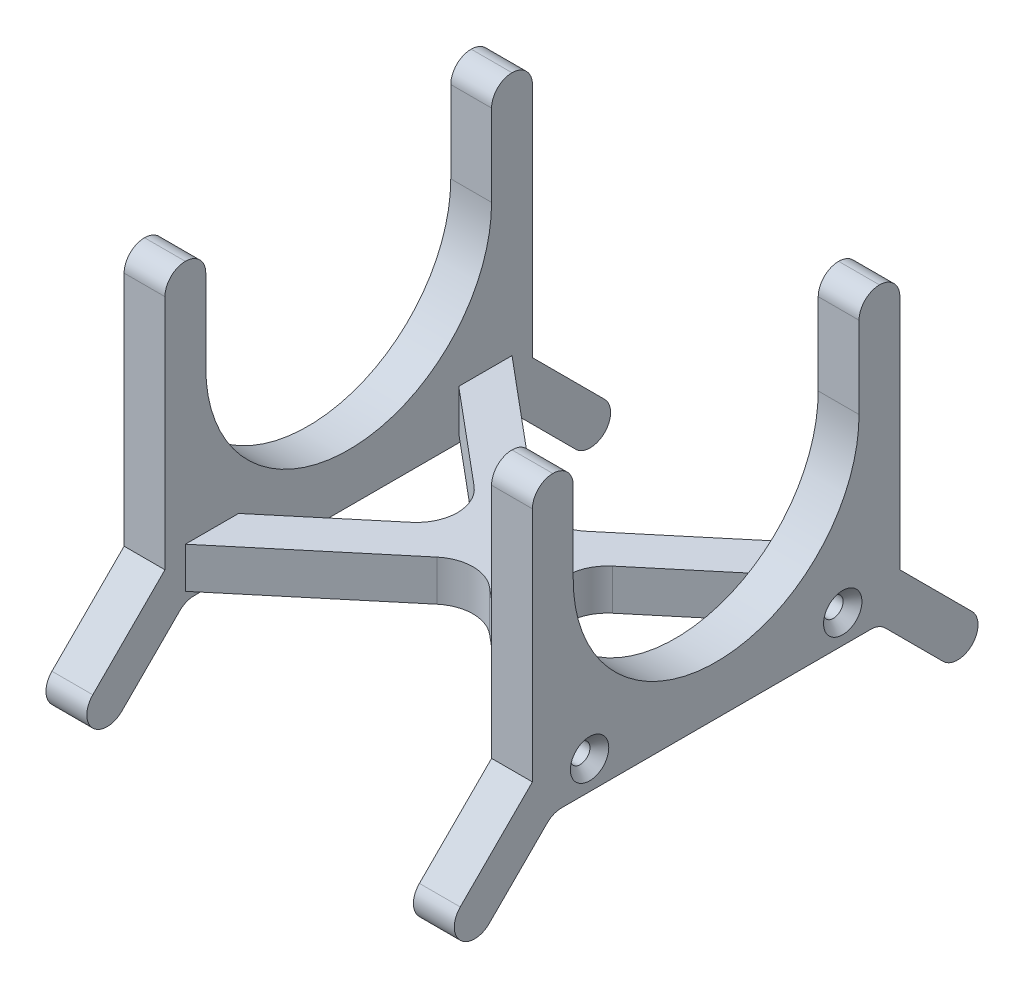
from build123d import *

# Parameters (mm, degrees)
BOSS_EXTRUDE1_DEPTH                            = 10
FILLET1_R                                      = 5
LPATTERN1_COUNT                                = 2
LPATTERN1_PITCH                                = 80
BOSS_EXTRUDE2_DEPTH                            = 10
FILLET2_R                                      = 10
F_6_0MM_DOWEL_HOLE1_OUTLINE_R                  = 3.1
F_6_0MM_DOWEL_HOLE1_DEPTH                      = 6
CSK_FOR_M4_FLAT_HEAD_MACHINE_SCREW3_AT_2_COUNT = 2
CSK_FOR_M4_FLAT_HEAD_MACHINE_SCREW3_AT_2_PITCH = 62
CSK_FOR_M4_FLAT_HEAD_MACHINE_SCREW4_AT_2_COUNT = 2
CSK_FOR_M4_FLAT_HEAD_MACHINE_SCREW4_AT_2_PITCH = 62


# Read off the part's stored shape, not the designer's step: Ø6.0mm Dowel Hole1
with BuildPart() as part:
    # Sketch1 → Boss-Extrude1 (new body)
    with BuildSketch(Plane(origin=(0, 0, 0), x_dir=(0, 0, -1), z_dir=(1, 0, 0))):
        with BuildLine():
            Line((-45, 70), (-45, 7.071067812))
            Line((-45, 7.071067812), (-66.213203436, -14.142135624))
            Line((-66.213203436, -14.142135624), (-59.142135624, -21.213203436))
            Line((-59.142135624, -21.213203436), (-39.928932188, -2))
            Line((-39.928932188, -2), (39.928932188, -2))
            Line((39.928932188, -2), (59.142135624, -21.213203436))
            Line((59.142135624, -21.213203436), (66.213203436, -14.142135624))
            Line((66.213203436, -14.142135624), (45, 7.071067812))
            Line((45, 7.071067812), (45, 70))
            Line((45, 70), (35, 70))
            Line((35, 70), (35, 45))
            ThreePointArc((35, 45), (0, 10), (-35, 45))
            Line((-35, 45), (-35, 70))
            Line((-35, 70), (-45, 70))
        make_face()
    extrude(amount=BOSS_EXTRUDE1_DEPTH)

    # Fillet1
    fillet1_edges = [part.edges().sort_by_distance(p)[0] for p in [
        (5, 70, -45),
        (5, 70, -35),
        (5, 70, 35),
        (5, 70, 45),
        (5, -14.142135624, 66.213203436),
        (5, -21.213203436, 59.142135624),
        (5, -21.213203436, -59.142135624),
        (5, -14.142135624, -66.213203436),
        (5, -2, 39.928932188),
        (5, -2, -39.928932188),
    ]]
    fillet(fillet1_edges, radius=FILLET1_R - 0.0001)  # a hair under: the kernel refuses the full size


with BuildPart() as lpattern1_1:
    # LPattern1: pattern copy
    add(part.part.moved(Location(Vector(1, 0, 0) * (1 * LPATTERN1_PITCH))))

    # Sketch10 → CSK for M4 Flat Head Machine Screw3 (revolve, cut)
    with BuildSketch(Plane(origin=(90, 5, -31), x_dir=(0, 0, -1), z_dir=(0, 1, 0))):
        Polygon((0, 0), (0, 100), (2.4, 100), (2.4, 2.3), (4.7, 0), align=None)
    csk_for_m4_flat_head_machine_screw3 = revolve(axis=Axis((96.35, 5, -31), (-1, 0, 0)), mode=Mode.SUBTRACT)

    # CSK for M4 Flat Head Machine Screw3 at 2: CSK for M4 Flat Head Machine Screw3 ×2
    with Locations(*[(0, 0, i * CSK_FOR_M4_FLAT_HEAD_MACHINE_SCREW3_AT_2_PITCH) for i in range(1, CSK_FOR_M4_FLAT_HEAD_MACHINE_SCREW3_AT_2_COUNT)]):
        add(csk_for_m4_flat_head_machine_screw3, mode=Mode.SUBTRACT)


with BuildPart() as body_3:
    # Sketch2 → Boss-Extrude2 (new body)
    with BuildSketch(Plane.XZ):
        Polygon((0, -26.959456928), (0, -40), (40, -6.520271536), (80, -40), (80, -26.959456928), (47.790112806, 0), (80, 26.959456928), (80, 40), (40, 6.520271536), (0, 40), (0, 26.959456928), (32.209887194, 0), align=None)
    extrude(amount=-BOSS_EXTRUDE2_DEPTH)

    # Fillet2
    fillet2_edges = [body_3.edges().sort_by_distance(p)[0] for p in [
        (32.209887194, 5, 0),
        (40, 5, 6.520271536),
        (47.790112806, 5, 0),
        (40, 5, -6.520271536),
    ]]
    fillet(fillet2_edges, radius=FILLET2_R)

    # Ø6.0mm Dowel Hole1 outline → Ø6.0mm Dowel Hole1 (cut)
    with BuildSketch(Plane.YZ):
        with Locations((5, 31)):
            Circle(F_6_0MM_DOWEL_HOLE1_OUTLINE_R)
        with Locations((5, -31)):
            Circle(F_6_0MM_DOWEL_HOLE1_OUTLINE_R)
    f_6_0mm_dowel_hole1 = extrude(amount=F_6_0MM_DOWEL_HOLE1_DEPTH, mode=Mode.SUBTRACT)

    # Mirror1: Ø6.0mm Dowel Hole1 across plane
    add(f_6_0mm_dowel_hole1.mirror(Plane.ZY.offset(-40)), mode=Mode.SUBTRACT)


with BuildPart() as body_4:
    # Mirror2: mirrored copy
    add(part.part.mirror(Plane(origin=(0, 0, 0), x_dir=(0, 0, 1), z_dir=(1, 0, 0))))

    # Sketch12 → CSK for M4 Flat Head Machine Screw4 (revolve, cut)
    with BuildSketch(Plane(origin=(-10, 5, -31), x_dir=(0, 0, 1), z_dir=(0, 1, 0))):
        Polygon((0, 0), (0, 100), (2.4, 100), (2.4, 2.3), (4.7, 0), align=None)
    csk_for_m4_flat_head_machine_screw4 = revolve(axis=Axis((-16.35, 5, -31), (1, 0, 0)), mode=Mode.SUBTRACT)

    # CSK for M4 Flat Head Machine Screw4 at 2: CSK for M4 Flat Head Machine Screw4 ×2
    with Locations(*[(0, 0, i * CSK_FOR_M4_FLAT_HEAD_MACHINE_SCREW4_AT_2_PITCH) for i in range(1, CSK_FOR_M4_FLAT_HEAD_MACHINE_SCREW4_AT_2_COUNT)]):
        add(csk_for_m4_flat_head_machine_screw4, mode=Mode.SUBTRACT)


solid = Compound([lpattern1_1.part, body_3.part, body_4.part])
